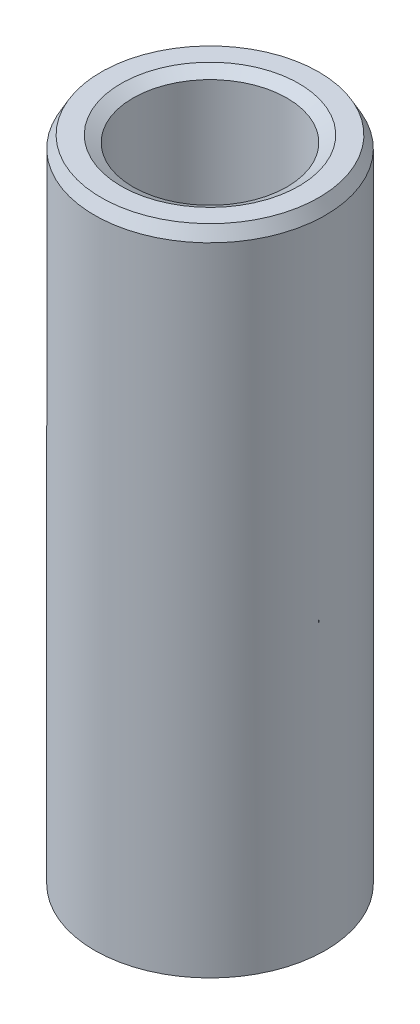
from build123d import *
from OCP.BRepFilletAPI import BRepFilletAPI_MakeChamfer

# Parameters (mm, degrees)
SKETCH1_R           = 37.5
BOSS_EXTRUDE1_DEPTH = 212.758597
SKETCH2_R           = 25.003153999
CUT_EXTRUDE1_DEPTH  = 220.268603766
CHAMFER1_SIZE       = 3.871911696
CHAMFER1_SIZE2      = 2.157789374


with BuildPart() as part:
    # Sketch1 → Boss-Extrude1 (new body)
    with BuildSketch(Plane(origin=(0, 0, 0), x_dir=(1, 0, 0), z_dir=(0, 1, 0))):
        Circle(SKETCH1_R)
    extrude(amount=BOSS_EXTRUDE1_DEPTH)

    # Sketch2 → Cut-Extrude1 (cut, through all)
    with BuildSketch(Plane(origin=(0, 0, 0), x_dir=(1, 0, 0), z_dir=(0, 1, 0))):
        Circle(SKETCH2_R)
    extrude(amount=CUT_EXTRUDE1_DEPTH, mode=Mode.SUBTRACT)

    # Chamfer1: one chamfer whose edges measure the first distance from different faces: ONE call of the kernel's chamfer builder (chamfer() names one face for all edges)
    chamfer1_edges_1 = [part.edges().sort_by_distance(p)[0] for p in [
        (-25.003153999, 212.758597, 0),
    ]]
    chamfer1_side_1 = [part.faces().sort_by_distance(p)[0] for p in [
        (-36.439339828, 212.758597, 0),
    ]]
    chamfer1_edges_2 = [part.edges().sort_by_distance(p)[0] for p in [
        (-25.003153999, 0, 0),
    ]]
    chamfer1_side_2 = [part.faces().sort_by_distance(p)[0] for p in [
        (-25.003153999, 106.3792985, 0),
    ]]
    chamfer1_edges_3 = [part.edges().sort_by_distance(p)[0] for p in [
        (-37.5, 0, 0),
    ]]
    chamfer1_side_3 = [part.faces().sort_by_distance(p)[0] for p in [
        (-36.439339828, 0, 0),
    ]]
    chamfer1_edges_4 = [part.edges().sort_by_distance(p)[0] for p in [
        (-37.5, 212.758597, 0),
    ]]
    chamfer1_side_4 = [part.faces().sort_by_distance(p)[0] for p in [
        (-37.5, 106.3792985, 0),
    ]]
    chamfer1 = BRepFilletAPI_MakeChamfer(part.part.solid().wrapped)
    for e in chamfer1_edges_1:
        chamfer1.Add(CHAMFER1_SIZE, CHAMFER1_SIZE2, e.wrapped, chamfer1_side_1[0].wrapped)  # the first distance lies on this face
    for e in chamfer1_edges_2:
        chamfer1.Add(CHAMFER1_SIZE, CHAMFER1_SIZE2, e.wrapped, chamfer1_side_2[0].wrapped)  # the first distance lies on this face
    for e in chamfer1_edges_3:
        chamfer1.Add(CHAMFER1_SIZE, CHAMFER1_SIZE2, e.wrapped, chamfer1_side_3[0].wrapped)  # the first distance lies on this face
    for e in chamfer1_edges_4:
        chamfer1.Add(CHAMFER1_SIZE, CHAMFER1_SIZE2, e.wrapped, chamfer1_side_4[0].wrapped)  # the first distance lies on this face
    add(Compound.cast(chamfer1.Shape()), mode=Mode.REPLACE)


solid = part.part
